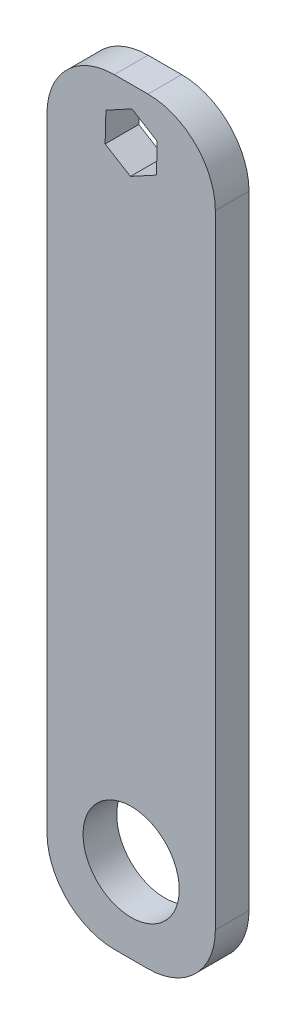
from build123d import *

# Parameters (mm, degrees)
SKETCH1_W           = 50
SKETCH1_H           = 10
BOSS_EXTRUDE1_DEPTH = 112.5
SKETCH2_R           = 14.2875
CUT_EXTRUDE1_DEPTH  = 127
FILLET1_R           = 20


with BuildPart() as part:
    # Sketch1 → Boss-Extrude1 (new, symmetric)
    with BuildSketch(Plane(origin=(0, 0, 0), x_dir=(1, 0, 0), z_dir=(0, 1, 0))):
        Rectangle(SKETCH1_W, SKETCH1_H)
    extrude(amount=BOSS_EXTRUDE1_DEPTH, both=True)

    # Sketch2 → Cut-Extrude1 (cut)
    with BuildSketch(Plane.XY.offset(5)):
        with Locations((0, -87.5)):
            Circle(SKETCH2_R)
        Polygon((7.504059245, 92.904023719), (7.732261837, 101.700717798), (0.228202592, 106.296694079), (-7.504059245, 102.095976281), (-7.732261837, 93.299282202), (-0.228202592, 88.703305921), align=None)
    extrude(amount=-CUT_EXTRUDE1_DEPTH, mode=Mode.SUBTRACT)

    # Fillet1
    fillet1_edges = [part.edges().sort_by_distance(p)[0] for p in [
        (-25, -112.5, 0),
        (25, -112.5, 0),
        (25, 112.5, 0),
        (-25, 112.5, 0),
    ]]
    fillet(fillet1_edges, radius=FILLET1_R)


solid = part.part
